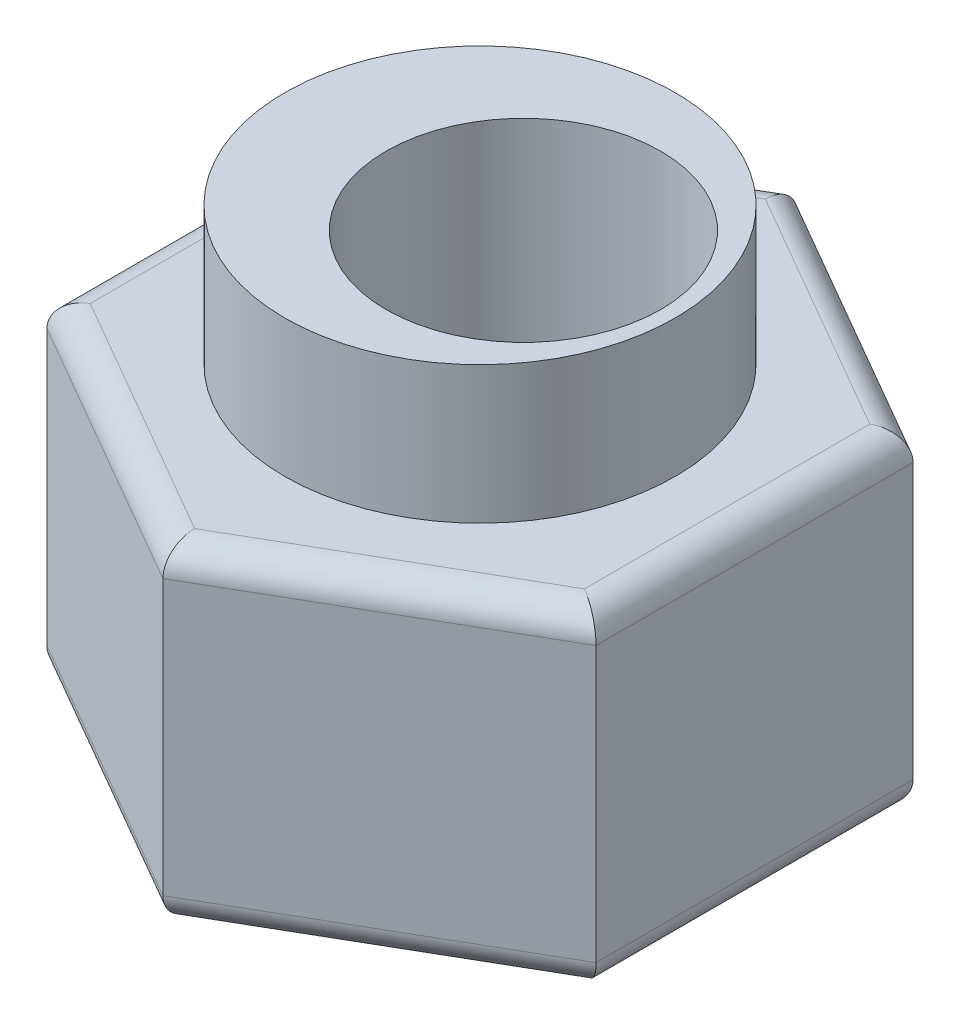
from build123d import *

# Parameters (mm, degrees)
BOSS_EXTRUDE1_DEPTH = 6
SKETCH2_R           = 3.555
BOSS_EXTRUDE2_DEPTH = 2.5
SKETCH3_R           = 2.5
CUT_EXTRUDE1_DEPTH  = 12.427306478
FILLET1_R           = 0.5


with BuildPart() as part:
    # Sketch1 → Boss-Extrude1 (new body)
    with BuildSketch(Plane(origin=(0, 0, 0), x_dir=(1, 0, 0), z_dir=(0, 1, 0))):
        Polygon((5, -2.886751346), (5, 2.886751346), (0, 5.773502692), (-5, 2.886751346), (-5, -2.886751346), (0, -5.773502692), align=None)
    extrude(amount=BOSS_EXTRUDE1_DEPTH)

    # Sketch2 → Boss-Extrude2 (add)
    with BuildSketch(Plane(origin=(0, 6, 0), x_dir=(1, 0, 0), z_dir=(0, 1, 0))):
        Circle(SKETCH2_R)
    extrude(amount=BOSS_EXTRUDE2_DEPTH)

    # Sketch3 → Cut-Extrude1 (cut, through all)
    with BuildSketch(Plane(origin=(0, 8.5, 0), x_dir=(1, 0, 0), z_dir=(0, 1, 0))):
        with Locations((0.79, 0)):
            Circle(SKETCH3_R)
    extrude(amount=-CUT_EXTRUDE1_DEPTH, mode=Mode.SUBTRACT)

    # Fillet1
    fillet1_edges = [part.edges().sort_by_distance(p)[0] for p in [
        (5, 0, 0),
        (2.5, 0, -4.330127019),
        (-2.5, 0, -4.330127019),
        (-5, 0, 0),
        (-2.5, 0, 4.330127019),
        (2.5, 0, 4.330127019),
        (-5, 6, 0),
        (-2.5, 6, -4.330127019),
        (2.5, 6, -4.330127019),
        (5, 6, 0),
        (2.5, 6, 4.330127019),
        (-2.5, 6, 4.330127019),
    ]]
    fillet(fillet1_edges, radius=FILLET1_R)


solid = part.part
